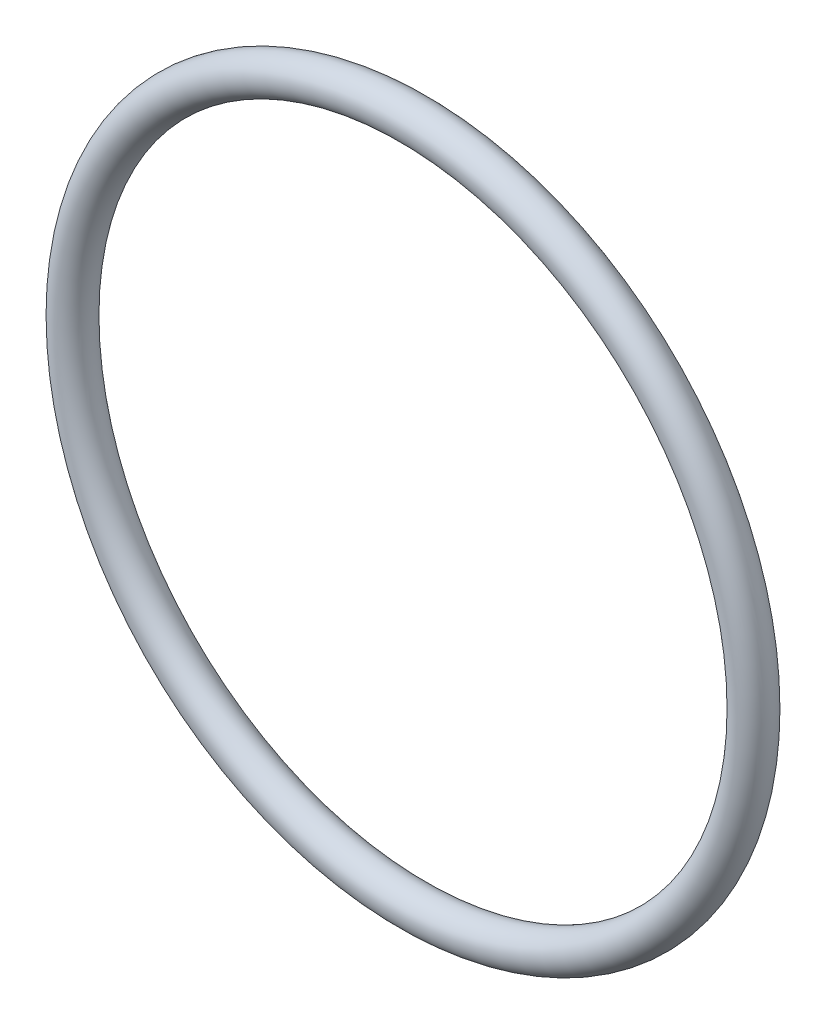
from build123d import *

# Parameters (mm, degrees)
SKETCH1_R = 0.635


with BuildPart() as part:
    # Sketch1 → Revolve1 (revolve)
    with BuildSketch(Plane(origin=(0, 0, 0), x_dir=(1, 0, 0), z_dir=(0, 1, 0))):
        Circle(SKETCH1_R)
    revolve(axis=Axis((11.557, 0, 0), (0, 0, -1)))


solid = part.part
